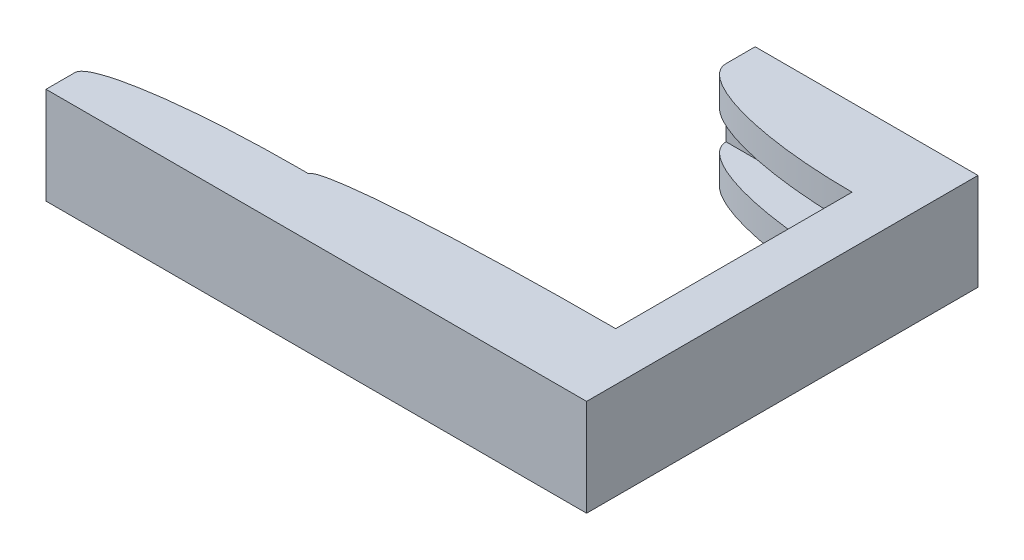
from build123d import *

# Parameters (mm, degrees)
SKETCH1_W           = 27.9
SKETCH1_H           = 20.2
BOSS_EXTRUDE2_DEPTH = 5
CUT_EXTRUDE3_DEPTH  = 5
SKETCH5_W           = 17.2
SKETCH5_H           = 2
CUT_EXTRUDE4_DEPTH  = 26.4
FILLET1_SIZE        = 2.5
FILLET1_SIZE_2      = 9
FILLET2_SIZE        = 9
FILLET2_SIZE_2      = 2.5
FILLET3_SIZE        = 1
FILLET3_SIZE_2      = 14.5
FILLET4_DEPTH       = 1.5
FILLET5_START       = 3.5
FILLET5_DEPTH       = 1.5
FILLET6_DEPTH       = 1.5


with BuildPart() as part:
    # Sketch1 → Boss-Extrude2 (new body)
    with BuildSketch(Plane(origin=(0, 0, 0), x_dir=(1, 0, 0), z_dir=(0, 1, 0))):
        with Locations((-55.325764497, -25.209039536)):
            Rectangle(SKETCH1_W, SKETCH1_H)
    extrude(amount=BOSS_EXTRUDE2_DEPTH)

    # Sketch4 → Cut-Extrude3 (cut)
    with BuildSketch(Plane(origin=(0, 5, 0), x_dir=(1, 0, 0), z_dir=(0, 1, 0))):
        Polygon((-69.275764497, -32.309039536), (-58.719837606, -32.309039536), (-58.719837606, -31.309039536), (-43.875764497, -31.309039536), (-43.875764497, -19.109039536), (-52.875764497, -19.109039536), (-52.875764497, -15.109039536), (-69.275764497, -15.109039536), align=None)
    extrude(amount=-CUT_EXTRUDE3_DEPTH, mode=Mode.SUBTRACT)

    # Sketch5 → Cut-Extrude4 (cut)
    with BuildSketch(Plane.ZY.offset(69.275764497)):
        with Locations((25.209039536, 2.5)):
            Rectangle(SKETCH5_W, SKETCH5_H)
    extrude(amount=-CUT_EXTRUDE4_DEPTH, mode=Mode.SUBTRACT)

    # Fillet1
    # a fillet whose section is not a circle: 9, 2.5 mm, written as the material it takes off along each edge
    with BuildSketch(Plane(origin=(-52.875764497, 27.5, 19.109039536), x_dir=(0, 0, -1), z_dir=(0, -1, 0))) as fillet1_piece_1_section:
        with BuildLine():
            Bezier((FILLET1_SIZE, 0), (0, 0), (0, FILLET1_SIZE_2), weights=[1, 0.707106781, 1])
            Line((0, FILLET1_SIZE_2), (0, 0))
            Line((0, 0), (FILLET1_SIZE, 0))
        make_face()
    fillet1_piece_1 = extrude(amount=46.5, mode=Mode.PRIVATE)
    fillet1_piece_1 = split(fillet1_piece_1, bisect_by=Plane(origin=(-52.875764497, 1.5, 19.109039536), z_dir=(0, 1, 0)), keep=Keep.TOP, mode=Mode.PRIVATE)
    add(fillet1_piece_1, mode=Mode.SUBTRACT)

    # Fillet2
    # a fillet whose section is not a circle: 9, 2.5 mm, written as the material it takes off along each edge
    with BuildSketch(Plane(origin=(-52.875764497, 24, 19.109039536), x_dir=(1, 0, 0), z_dir=(0, -1, 0))) as fillet2_piece_1:
        with BuildLine():
            Bezier((FILLET2_SIZE, 0), (0, 0), (0, -FILLET2_SIZE_2), weights=[1, 0.707106781, 1])
            Line((0, -FILLET2_SIZE_2), (0, 0))
            Line((0, 0), (FILLET2_SIZE, 0))
        make_face()
    extrude(amount=46.5, mode=Mode.SUBTRACT)

    # Fillet3
    # a fillet whose section is not a circle: 14.5, 1 mm, written as the material it takes off along each edge
    with BuildSketch(Plane(origin=(-58.719837606, 41.25, 31.309039536), x_dir=(0, 0, 1), z_dir=(0, -1, 0))) as fillet3_piece_1_section:
        with BuildLine():
            Bezier((FILLET3_SIZE, 0), (0, 0), (0, -FILLET3_SIZE_2), weights=[1, 0.707106781, 1])
            Line((0, -FILLET3_SIZE_2), (0, 0))
            Line((0, 0), (FILLET3_SIZE, 0))
        make_face()
    fillet3_piece_1 = extrude(amount=74, mode=Mode.PRIVATE)
    fillet3_piece_1 = split(fillet3_piece_1, bisect_by=Plane(origin=(-58.719837606, 1.5, 31.309039536), z_dir=(0, 1, 0)), keep=Keep.TOP, mode=Mode.PRIVATE)
    add(fillet3_piece_1, mode=Mode.SUBTRACT)

    # Fillet4: read off the stored shape, not the designer's step
    # Fillet4 outline → Fillet4 (cut)
    with BuildSketch(Plane(origin=(0, 0, 0), x_dir=(1, 0, 0), z_dir=(0, 1, 0))):
        with BuildLine():
            add(Edge.make_bspline(
                [(-44.219837606, -31.309039536), (-58.719837606, -31.309039536), (-58.719837606, -32.309039536)],
                knots=[0, 0, 0, 1, 1, 1], degree=2, weights=[1, 0.707106781, 1]))
            Line((-44.219837606, -31.309039536), (-58.719837606, -31.309039536))
            Line((-58.719837606, -31.309039536), (-58.719837606, -32.309039536))
        make_face()
    extrude(amount=FILLET4_DEPTH, mode=Mode.SUBTRACT)

    # Fillet5: read off the stored shape, not the designer's step
    # Fillet5 outline → Fillet5 (cut)
    with BuildSketch(Plane(origin=(0, 0, 0), x_dir=(1, 0, 0), z_dir=(0, 1, 0)).offset(FILLET5_START)):
        with BuildLine():
            add(Edge.make_bspline(
                [(-59.275764497, -32.309039536), (-69.275764497, -32.309039536), (-69.275764497, -33.809039536)],
                knots=[0, 0, 0, 1, 1, 1], degree=2, weights=[1, 0.707106781, 1]))
            Line((-59.275764497, -32.309039536), (-69.275764497, -32.309039536))
            Line((-69.275764497, -32.309039536), (-69.275764497, -33.809039536))
        make_face()
    extrude(amount=FILLET5_DEPTH, mode=Mode.SUBTRACT)

    # Fillet6: read off the stored shape, not the designer's step
    # Fillet6 outline → Fillet6 (cut)
    with BuildSketch(Plane(origin=(0, 0, 0), x_dir=(1, 0, 0), z_dir=(0, 1, 0))):
        with BuildLine():
            add(Edge.make_bspline(
                [(-59.275764497, -32.309039536), (-69.275764497, -32.309039536), (-69.275764497, -33.809039536)],
                knots=[0, 0, 0, 1, 1, 1], degree=2, weights=[1, 0.707106781, 1]))
            Line((-59.275764497, -32.309039536), (-69.275764497, -32.309039536))
            Line((-69.275764497, -32.309039536), (-69.275764497, -33.809039536))
        make_face()
    extrude(amount=FILLET6_DEPTH, mode=Mode.SUBTRACT)


solid = part.part
